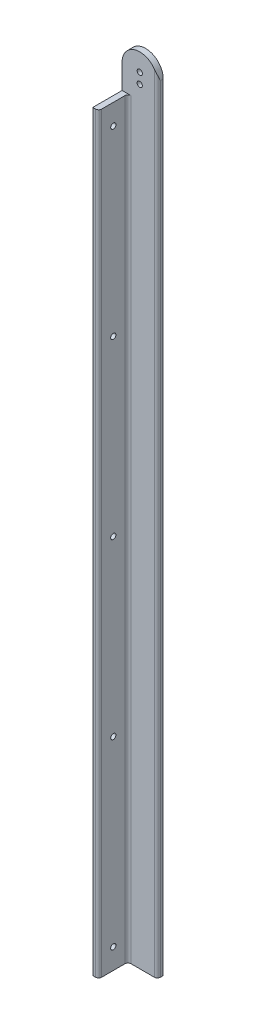
from build123d import *

# Parameters (mm, degrees)
BOSS_EXTRUDE1_DEPTH = 431.8
SKETCH4_W           = 15.875
SKETCH4_H           = 25.4
CUT_EXTRUDE1_DEPTH  = 6.35
SKETCH5_W           = 1.5875
SKETCH5_H           = 25.4
CUT_EXTRUDE2_DEPTH  = 6.35
SKETCH6_R           = 1.4224
CUT_EXTRUDE3_DEPTH  = 5.08
CUT_EXTRUDE4_START  = -2.54
CUT_EXTRUDE4_DEPTH  = 2.54
SKETCH8_R           = 1.4224
CUT_EXTRUDE5_DEPTH  = 5.08
SKETCH9_W           = 28.861002292
SKETCH9_H           = 547.524656259
CUT_EXTRUDE6_DEPTH  = 30.48
CUT_EXTRUDE7_DEPTH  = 5.08


with BuildPart() as part:
    # Sketch2 → Boss-Extrude1 (new body)
    with BuildSketch(Plane(origin=(0, 0, 0), x_dir=(1, 0, 0), z_dir=(0, 1, 0))):
        with BuildLine():
            Line((0, 0), (19.05, 0))
            Line((19.05, 0), (19.05, 1.5875))
            ThreePointArc((19.05, 1.5875), (18.585032015, 2.710032015), (17.4625, 3.175))
            Line((17.4625, 3.175), (4.7625, 3.175))
            ThreePointArc((4.7625, 3.175), (3.639967985, 3.639967985), (3.175, 4.7625))
            Line((3.175, 4.7625), (3.175, 17.4625))
            ThreePointArc((3.175, 17.4625), (2.710032015, 18.585032015), (1.5875, 19.05))
            Line((1.5875, 19.05), (0, 19.05))
            Line((0, 19.05), (0, 0))
        make_face()
    extrude(amount=BOSS_EXTRUDE1_DEPTH)

    # Sketch4 → Cut-Extrude1 (cut)
    with BuildSketch(Plane(origin=(3.175, 0, 0), x_dir=(0, 0, -1), z_dir=(1, 0, 0))):
        with Locations((11.1125, 419.1)):
            Rectangle(SKETCH4_W, SKETCH4_H)
    extrude(amount=-CUT_EXTRUDE1_DEPTH, mode=Mode.SUBTRACT)

    # Sketch5 → Cut-Extrude2 (cut)
    with BuildSketch(Plane.ZY.offset(-3.175)):
        with Locations((-3.96875, 419.1)):
            Rectangle(SKETCH5_W, SKETCH5_H)
    extrude(amount=-CUT_EXTRUDE2_DEPTH, mode=Mode.SUBTRACT)

    # Sketch6 → Cut-Extrude3 (cut)
    with BuildSketch(Plane(origin=(3.175, 0, 0), x_dir=(0, 0, -1), z_dir=(1, 0, 0))):
        with Locations((11.1125, 109.5375)):
            Circle(SKETCH6_R)
        with Locations((11.1125, 203.2)):
            Circle(SKETCH6_R)
        with Locations((11.1125, 296.8625)):
            Circle(SKETCH6_R)
        with Locations((11.1125, 11.1125)):
            Circle(SKETCH6_R)
        with Locations((11.1125, 395.2875)):
            Circle(SKETCH6_R)
    extrude(amount=-CUT_EXTRUDE3_DEPTH, mode=Mode.SUBTRACT)

    # Sketch7 → Cut-Extrude4 (cut)
    with BuildSketch(Plane(origin=(0, 431.8, 0), x_dir=(1, 0, 0), z_dir=(0, 1, 0)).offset(CUT_EXTRUDE4_START)):
        with BuildLine():
            Line((17.4625, 3.175), (0, 3.175))
            Line((0, 3.175), (0, 0))
            Line((0, 0), (19.05, 0))
            Line((19.05, 0), (19.05, 1.5875))
            ThreePointArc((19.05, 1.5875), (18.585032015, 2.710032015), (17.4625, 3.175))
        make_face()
    extrude(amount=CUT_EXTRUDE4_DEPTH, mode=Mode.SUBTRACT)

    # Sketch8 → Cut-Extrude5 (cut)
    with BuildSketch(Plane(origin=(0, 0, -3.175), x_dir=(-1, 0, 0), z_dir=(0, 0, -1))):
        with Locations((-9.525, 419.735)):
            Circle(SKETCH8_R)
        with Locations((-9.525, 414.02)):
            Circle(SKETCH8_R)
    extrude(amount=-CUT_EXTRUDE5_DEPTH, mode=Mode.SUBTRACT)


with BuildPart() as body_2:
    # Mirror3: mirrored copy
    add(part.part.mirror(Plane.XY.offset(2.54)))

    # Sketch10 → Cut-Extrude7 (cut)
    with BuildSketch(Plane.XY.offset(8.255)):
        with BuildLine():
            Line((19.05, 419.735), (19.05, 429.26))
            Line((19.05, 429.26), (9.525, 429.26))
            ThreePointArc((9.525, 429.26), (16.260192091, 426.470192091), (19.05, 419.735))
        make_face()
        with BuildLine():
            ThreePointArc((0, 419.735), (2.789807909, 426.470192091), (9.525, 429.26))
            Line((9.525, 429.26), (0, 429.26))
            Line((0, 429.26), (0, 419.735))
        make_face()
    extrude(amount=-CUT_EXTRUDE7_DEPTH, mode=Mode.SUBTRACT)


with BuildPart() as part_1:
    add(part.part)

    # Sketch9 → Cut-Extrude6 (cut)
    with BuildSketch(Plane.XY.offset(2.54)):
        with Locations((7.805746781, 195.778589833)):
            Rectangle(SKETCH9_W, SKETCH9_H)
    extrude(amount=-CUT_EXTRUDE6_DEPTH, mode=Mode.SUBTRACT)


solid = body_2.part
